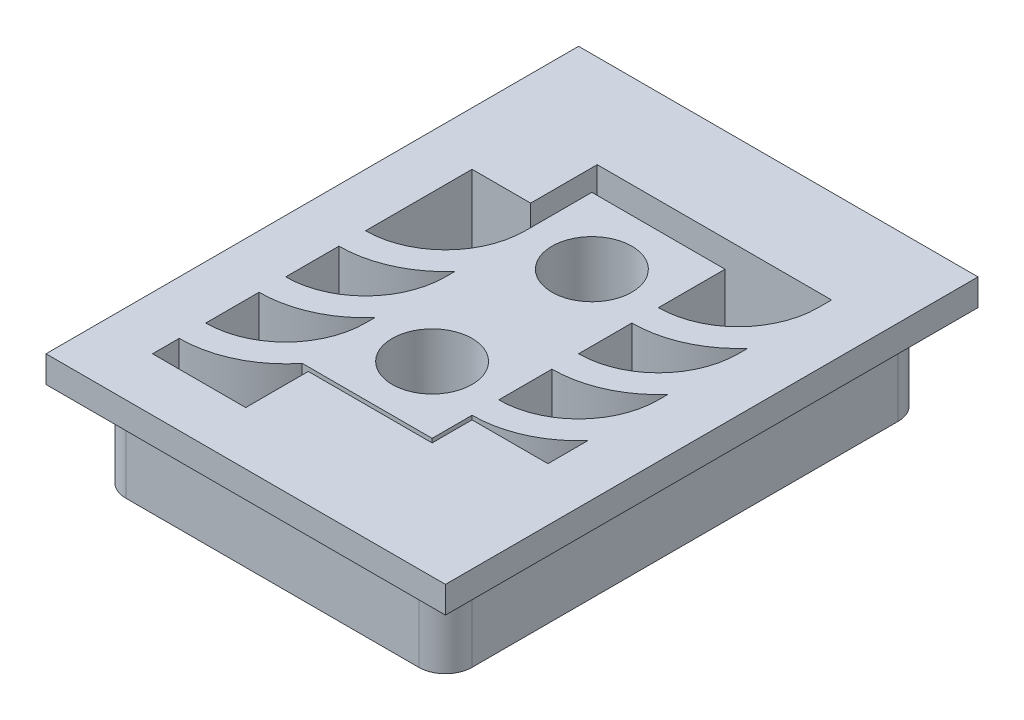
from build123d import *

# Parameters (mm, degrees)
SKETCH1_W           = 13
SKETCH1_H           = 18
BOSS_EXTRUDE1_DEPTH = 3.2
BOSS_EXTRUDE2_START = 1
SKETCH3_W           = 15
SKETCH3_H           = 20
SKETCH3_R           = 1.5
BOSS_EXTRUDE2_DEPTH = 1
FILLET1_R           = 1
CUT_EXTRUDE1_DEPTH  = 14.18673576


with BuildPart() as part:
    # Sketch1 → Boss-Extrude1 (new body)
    with BuildSketch(Plane(origin=(0, 0, 0), x_dir=(1, 0, 0), z_dir=(0, 1, 0))):
        Rectangle(SKETCH1_W, SKETCH1_H)
        with BuildLine():
            ThreePointArc((1.5, -3), (-1.060660172, -4.060660172), (0, -1.5))
            ThreePointArc((0, -1.5), (1.060660172, -1.939339828), (1.5, -3))
        make_face(mode=Mode.SUBTRACT)
        with BuildLine():
            ThreePointArc((1.5, 3), (1.060660172, 1.939339828), (0, 1.5))
            ThreePointArc((0, 1.5), (-1.060660172, 4.060660172), (1.5, 3))
        make_face(mode=Mode.SUBTRACT)
    extrude(amount=BOSS_EXTRUDE1_DEPTH)

    # Sketch3 → Boss-Extrude2 (add)
    with BuildSketch(Plane.XZ.offset(BOSS_EXTRUDE2_START)):
        Rectangle(SKETCH3_W, SKETCH3_H)
        with Locations((0, -3)):
            Circle(SKETCH3_R, mode=Mode.SUBTRACT)
        with Locations((0, 3)):
            Circle(SKETCH3_R, mode=Mode.SUBTRACT)
    extrude(amount=-BOSS_EXTRUDE2_DEPTH)

    # Fillet1
    fillet1_edges = [part.edges().sort_by_distance(p)[0] for p in [
        (6.5, 1.6, 9),
        (-6.5, 1.6, 9),
        (-6.5, 1.6, -9),
        (6.5, 1.6, -9),
    ]]
    fillet(fillet1_edges, radius=FILLET1_R)

    # Sketch2 → Cut-Extrude1 (cut, through all)
    with BuildSketch(Plane(origin=(0, 3.2, 0), x_dir=(1, 0, 0), z_dir=(0, 1, 0))):
        with BuildLine():
            Line((-2.5, -3), (-2.5, -2.645751311))
            ThreePointArc((-2.5, -2.645751311), (-3.854248689, -3.645751311), (-5.5, -4))
            Line((-5.5, -4), (-5.5, -6))
            ThreePointArc((-5.5, -6), (-3.378679656, -5.121320344), (-2.5, -3))
        make_face()
        with BuildLine():
            Line((2.5, -1), (2.5, -3))
            ThreePointArc((2.5, -3), (4.621320344, -2.121320344), (5.5, 0))
            Line((5.5, 0), (5.5, 0.354248689))
            ThreePointArc((5.5, 0.354248689), (4.145751311, -0.645751311), (2.5, -1))
        make_face()
        with BuildLine():
            Line((-5.5, -1), (-5.5, -3))
            ThreePointArc((-5.5, -3), (-3.378679656, -2.121320344), (-2.5, 0))
            Line((-2.5, 0), (-2.5, 0.354248689))
            ThreePointArc((-2.5, 0.354248689), (-3.854248689, -0.645751311), (-5.5, -1))
        make_face()
        with BuildLine():
            ThreePointArc((-2.377501001, -5.5), (-3.767949192, -6.605551275), (-5.5, -7))
            Line((-5.5, -7), (-5.5, -8))
            Line((-5.5, -8), (-2, -8))
            Line((-2, -8), (-2, -5.65))
            Line((-2, -5.65), (2.65, -5.65))
            Line((2.65, -5.65), (2.65, -4.15))
            Line((2.65, -4.15), (5.5, -4.15))
            Line((5.5, -4.15), (5.5, -2.645751311))
            ThreePointArc((5.5, -2.645751311), (4.145751311, -3.645751311), (2.5, -4))
            Line((2.5, -4), (2.5, -5.5))
            Line((2.5, -5.5), (-2.377501001, -5.5))
        make_face()
        with BuildLine():
            Line((2.5, 2), (2.5, 0))
            ThreePointArc((2.5, 0), (4.621320344, 0.878679656), (5.5, 3))
            Line((5.5, 3), (5.5, 3.354248689))
            ThreePointArc((5.5, 3.354248689), (4.145751311, 2.354248689), (2.5, 2))
        make_face()
        with BuildLine():
            Line((-5.5, 4), (-5.5, 0))
            ThreePointArc((-5.5, 0), (-3.378679656, 0.878679656), (-2.5, 3))
            Line((-2.5, 3), (-2.5, 5.5))
            Line((-2.5, 5.5), (2.5, 5.5))
            Line((2.5, 5.5), (2.5, 3))
            ThreePointArc((2.5, 3), (4.621320344, 3.878679656), (5.5, 6))
            Line((5.5, 6), (5.5, 6.5))
            Line((5.5, 6.5), (-3.3, 6.5))
            Line((-3.3, 6.5), (-3.3, 4))
            Line((-3.3, 4), (-5.5, 4))
        make_face()
    extrude(amount=-CUT_EXTRUDE1_DEPTH, mode=Mode.SUBTRACT)


with BuildPart() as body_2:
    # Mirror1: mirrored copy
    add(part.part.mirror(Plane(origin=(0, -1, 0), x_dir=(0, 0, 1), z_dir=(0, -1, 0))))


solid = body_2.part
